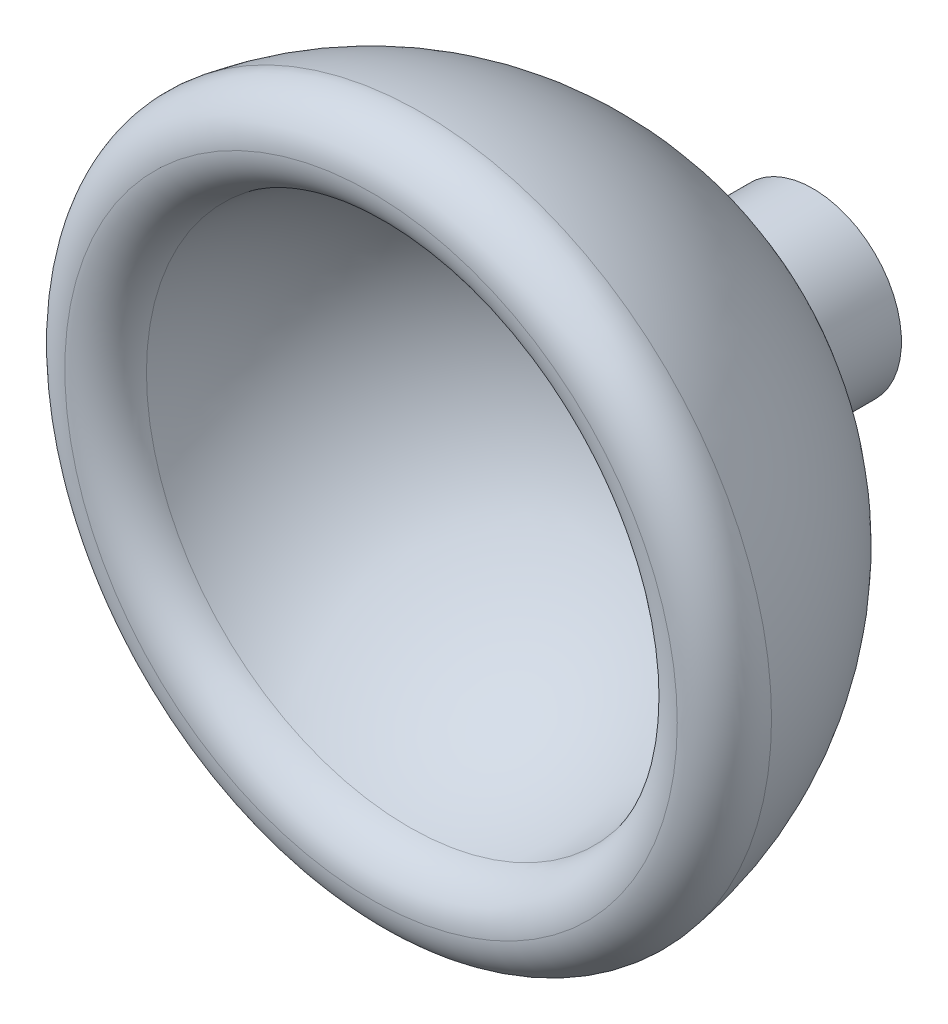
from build123d import *

# Parameters (mm, degrees)
FILLET3_R = 5


with BuildPart() as part:
    # Sketch1 → Revolve4 (revolve)
    with BuildSketch(Plane(origin=(0, 0, 0), x_dir=(1, 0, 0), z_dir=(0, 1, 0)), mode=Mode.PRIVATE) as revolve4_sk:
        with BuildLine():
            Line((0, 40), (1.22e-15, 30))
            ThreePointArc((1.22e-15, 30), (21.213203435596427, 21.213203435596427), (30, -1.22e-15))
            Line((30, -1.22e-15), (40, 0))
            ThreePointArc((40, 0), (31.62277660168379, 24.494897427831773), (9.999999999999998, 38.72983346207416))
            Line((9.999999999999998, 38.72983346207416), (10.000000000000002, 50))
            Line((10.000000000000002, 50), (2.45e-15, 50))
            Line((2.45e-15, 50), (0, 40))
        make_face()
    revolve(revolve4_sk.sketch.rotate(Axis((2.45e-15, 0, -50), (-2.4e-16, 0, 1)), 180), axis=Axis((2.45e-15, 0, -50), (-2.4e-16, 0, 1)))

    # Fillet3
    # the kernel refuses this fillet: 5 mm, written as the material it takes off along each edge
    with BuildSketch(Plane(origin=(-9.8e-15, 0, -7.11e-15), x_dir=(-1, 1.2e-16, -2.4e-16), z_dir=(1.2e-16, 1, 0))) as fillet3_piece_1:
        with BuildLine():
            CenterArc((34.641016151377556, -5.000000000000001), FILLET3_R, 90, 81.78678929826185)
            Line((34.641016151377556, -1.29e-15), (30.000000000000007, 0))
            ThreePointArc((30.000000000000007, 0), (29.922976011333738, -2.1483730181571907), (29.69229955832362, -4.2857142857142865))
        make_face()
    revolve(axis=Axis((-9.8e-15, 0, -7.11e-15), (-2.4e-16, 0, 1)), mode=Mode.SUBTRACT)
    with BuildSketch(Plane(origin=(-9.8e-15, 0, -1.421e-14), x_dir=(-1, 1.2e-16, -2.4e-16), z_dir=(1.2e-16, 1, 0))) as fillet3_piece_2:
        with BuildLine():
            CenterArc((34.64101615137755, -4.999999999999993), FILLET3_R, 351.78678929826174, 98.21321070173826)
            ThreePointArc((39.58973274443148, -5.714285714285711), (39.89730134844499, -2.8644973575429207), (40.000000000000014, 0))
            Line((40.000000000000014, 0), (34.64101615137755, 6.71e-15))
        make_face()
    revolve(axis=Axis((-9.8e-15, 0, -1.421e-14), (-2.4e-16, 0, 1)), mode=Mode.SUBTRACT)


solid = part.part
